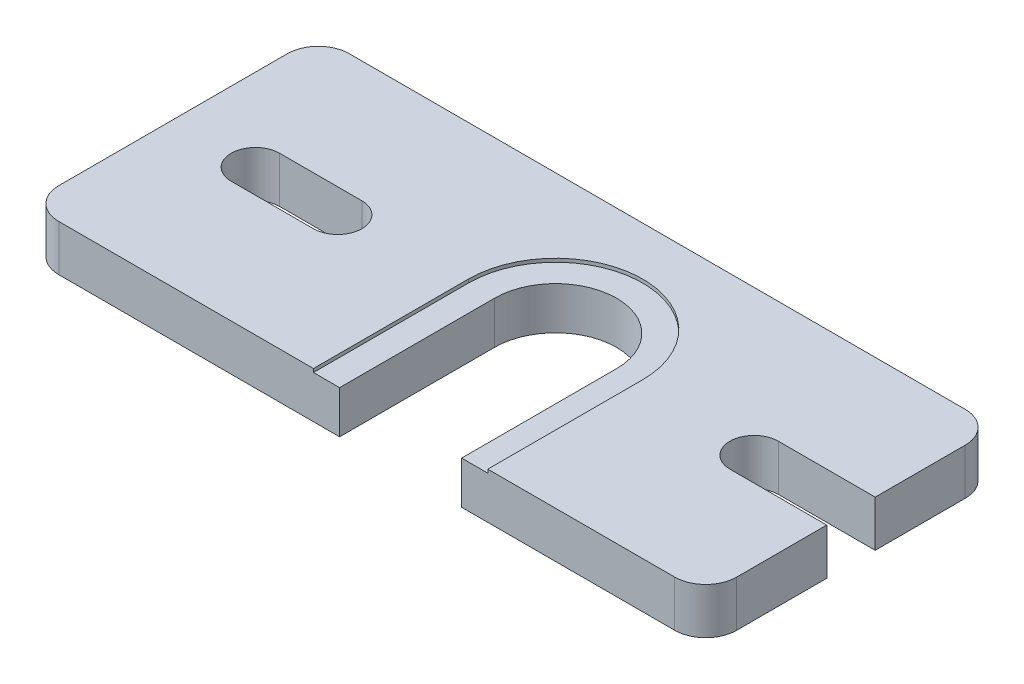
from build123d import *

# Parameters (mm, degrees)
BASE_FLANGE1_DEPTH      = 4.4
CUT_EXTRUDE1_DEPTH      = 10.36
CUT_EXTRUDE1_DEPTH_BACK = 4.76
CUT_EXTRUDE2_DEPTH      = 4.76
BOSS_EXTRUDE1_START     = 0.36
BOSS_EXTRUDE1_DEPTH     = 0.36


# Sheet-metal steps are written as plain solids
with BuildPart() as part:
    # Sketch2 → Base-Flange1 (new body)
    with BuildSketch(Plane(origin=(0, 0, 0), x_dir=(1, 0, 0), z_dir=(0, 1, 0))):
        with BuildLine():
            Line((-33.306696524, 16.994496658), (30.293303476, 16.994496658))
            ThreePointArc((30.293303476, 16.994496658), (32.556045176, 16.057238357), (33.493303476, 13.794496658))
            Line((33.493303476, 13.794496658), (33.493303476, -9.805503342))
            ThreePointArc((33.493303476, -9.805503342), (32.556045176, -12.068245042), (30.293303476, -13.005503342))
            Line((30.293303476, -13.005503342), (-33.306696524, -13.005503342))
            ThreePointArc((-33.306696524, -13.005503342), (-35.569438223, -12.068245042), (-36.506696524, -9.805503342))
            Line((-36.506696524, -9.805503342), (-36.506696524, 13.794496658))
            ThreePointArc((-36.506696524, 13.794496658), (-35.569438223, 16.057238357), (-33.306696524, 16.994496658))
        make_face()
    extrude(amount=-BASE_FLANGE1_DEPTH)

    # Sketch7 → Cut-Extrude1 (cut, two sides: drawn at the far end of the back side and taken through both)
    with BuildSketch(Plane(origin=(0, 0, 0), x_dir=(1, 0, 0), z_dir=(0, 1, 0)).offset(-CUT_EXTRUDE1_DEPTH_BACK)):
        with BuildLine():
            Line((-28.006696524, 4.494496658), (-19.506696524, 4.494496658))
            ThreePointArc((-19.506696524, 4.494496658), (-17.006696524, 1.994496658), (-19.506696524, -0.505503342))
            Line((-19.506696524, -0.505503342), (-28.006696524, -0.505503342))
            ThreePointArc((-28.006696524, -0.505503342), (-30.506696524, 1.994496658), (-28.006696524, 4.494496658))
        make_face()
        with BuildLine():
            Line((23.493303476, 4.494496658), (33.493303476, 4.494496658))
            ThreePointArc((33.493303476, 4.494496658), (35.993303476, 1.994496658), (33.493303476, -0.505503342))
            Line((33.493303476, -0.505503342), (23.493303476, -0.505503342))
            ThreePointArc((23.493303476, -0.505503342), (20.993303476, 1.994496658), (23.493303476, 4.494496658))
        make_face()
    extrude(amount=CUT_EXTRUDE1_DEPTH + CUT_EXTRUDE1_DEPTH_BACK, mode=Mode.SUBTRACT)

    # Sketch8 → Cut-Extrude2 (cut)
    with BuildSketch(Plane(origin=(0, 0, 0), x_dir=(1, 0, 0), z_dir=(0, 1, 0))):
        with BuildLine():
            Line((8.293303476, 2.994496658), (8.293303476, -13.005503342))
            ThreePointArc((8.293303476, -13.005503342), (1.993303476, -19.305503342), (-4.306696524, -13.005503342))
            Line((-4.306696524, -13.005503342), (-4.306696524, 2.994496658))
            ThreePointArc((-4.306696524, 2.994496658), (1.993303476, 9.294496658), (8.293303476, 2.994496658))
        make_face()
    extrude(amount=-CUT_EXTRUDE2_DEPTH, mode=Mode.SUBTRACT)

    # Sketch11 → Boss-Extrude1 (add)
    with BuildSketch(Plane(origin=(0, 0, 0), x_dir=(1, 0, 0), z_dir=(0, 1, 0)).offset(BOSS_EXTRUDE1_START)):
        with BuildLine():
            Line((-36.506696524, 13.794496658), (-36.506696524, -9.805503342))
            ThreePointArc((-36.506696524, -9.805503342), (-35.569438223, -12.068245042), (-33.306696524, -13.005503342))
            Line((-33.306696524, -13.005503342), (-7.006696524, -13.005503342))
            Line((-7.006696524, -13.005503342), (-7.006696524, 2.994496658))
            ThreePointArc((-7.006696524, 2.994496658), (1.993303476, 11.994496658), (10.993303476, 2.994496658))
            Line((10.993303476, 2.994496658), (10.993303476, -13.005503342))
            Line((10.993303476, -13.005503342), (30.293303476, -13.005503342))
            ThreePointArc((30.293303476, -13.005503342), (32.556045176, -12.068245042), (33.493303476, -9.805503342))
            Line((33.493303476, -9.805503342), (33.493303476, -0.505503342))
            Line((33.493303476, -0.505503342), (23.493303476, -0.505503342))
            ThreePointArc((23.493303476, -0.505503342), (20.993303476, 1.994496658), (23.493303476, 4.494496658))
            Line((23.493303476, 4.494496658), (33.493303476, 4.494496658))
            Line((33.493303476, 4.494496658), (33.493303476, 13.794496658))
            ThreePointArc((33.493303476, 13.794496658), (32.556045176, 16.057238357), (30.293303476, 16.994496658))
            Line((30.293303476, 16.994496658), (-33.306696524, 16.994496658))
            ThreePointArc((-33.306696524, 16.994496658), (-35.569438223, 16.057238357), (-36.506696524, 13.794496658))
        make_face()
        with BuildLine():
            Line((-19.506696524, 4.494496658), (-28.006696524, 4.494496658))
            ThreePointArc((-28.006696524, 4.494496658), (-30.506696524, 1.994496658), (-28.006696524, -0.505503342))
            Line((-28.006696524, -0.505503342), (-19.506696524, -0.505503342))
            ThreePointArc((-19.506696524, -0.505503342), (-17.006696524, 1.994496658), (-19.506696524, 4.494496658))
        make_face(mode=Mode.SUBTRACT)
    extrude(amount=-BOSS_EXTRUDE1_DEPTH)


solid = part.part
